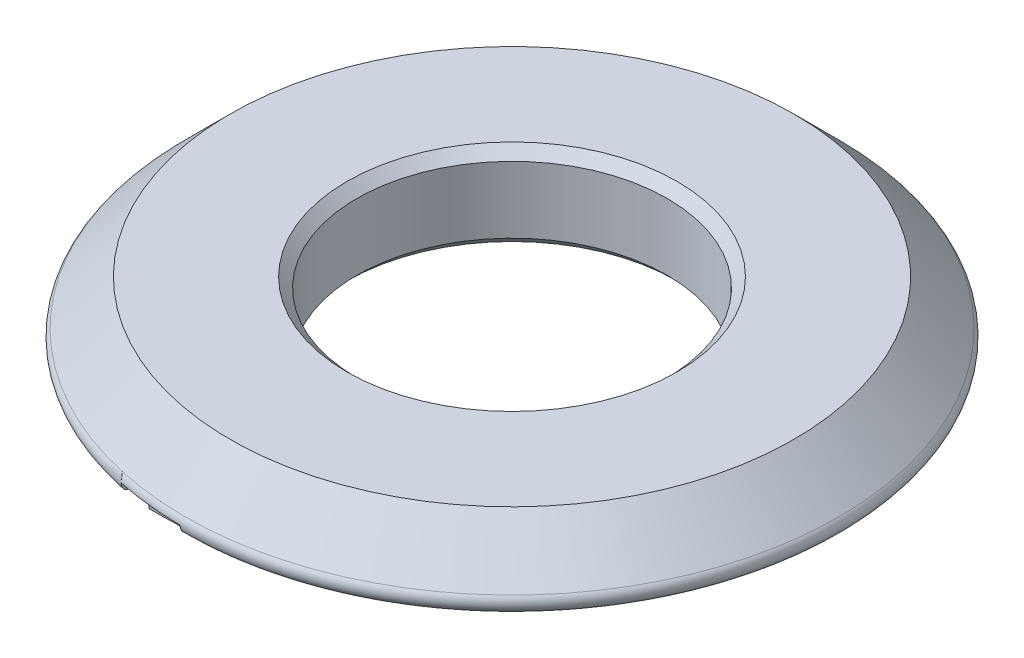
from build123d import *

# Parameters (mm, degrees)
CUT_EXTRUDE1_DEPTH = 0.254
FILLET1_R          = 0.254
CHAMFER1_SIZE      = 0.254


with BuildPart() as part:
    # Sketch1 → Revolve1 (revolve)
    with BuildSketch(Plane(origin=(0, 0, 0), x_dir=(0, 0, -1), z_dir=(1, 0, 0))):
        Polygon((4, 1.5875), (7.2644, 1.5875), (8.8519, 0), (5.001617421, 0), (4.635, -0.635), (4, -0.635), align=None)
    revolve(axis=Axis((0, 0, 0), (0, 1, 0)))

    # Sketch2 → Cut-Extrude1 (cut)
    with BuildSketch(Plane.XZ):
        with BuildLine():
            add(Edge.make_bspline(
                [(-0.381744141, 8.255992421), (-0.394148352, 8.256178311), (-0.423187535, 8.256613494), (-0.473293055, 8.259130399), (-0.53654551, 8.262859643), (-0.613190554, 8.268138747), (-0.703230056, 8.274867629), (-0.806419208, 8.283046817), (-0.922749653, 8.292772007), (-1.004591888, 8.299872891), (-1.04775, 8.303617421)],
                knots=[0, 0, 0, 0, 0.445813027, 1.043681475, 1.802721911, 2.723031118, 3.80466259, 5.047648995, 6.443127856, 8, 8, 8, 8], degree=3))
            add(Edge.make_bspline(
                [(-1.04775, 8.303617421), (-1.051396425, 8.263199144), (-1.058996997, 8.178951697), (-1.067294907, 8.0476609), (-1.076124262, 7.906819915), (-1.08128668, 7.756435685), (-1.087173295, 7.596473325), (-1.089413647, 7.427021867), (-1.092090416, 7.247938075), (-1.092293844, 7.125396111), (-1.092398438, 7.062390858)],
                knots=[0, 0, 0, 0, 0.783875404, 1.633901941, 2.541011057, 3.50963479, 4.54033398, 5.632943764, 6.782972208, 8, 8, 8, 8], degree=3))
            Line((-1.092398438, 7.062390858), (-1.095375, 5.922367421))
            add(Edge.make_bspline(
                [(-1.095375, 5.922367421), (-0.981029397, 5.924722631), (-0.750122342, 5.929478691), (-0.519166273, 5.92969808), (-0.402580078, 5.929808827)],
                knots=[0, 0, 0, 0, 0.990403717, 2, 2, 2, 2], degree=3))
            add(Edge.make_bspline(
                [(-0.402580078, 5.929808827), (-0.3778846, 5.928842867), (-0.330203814, 5.92697784), (-0.262128287, 5.907417169), (-0.200566431, 5.87590303), (-0.147812513, 5.83146931), (-0.102652506, 5.780410203), (-0.071321194, 5.721641824), (-0.05030196, 5.658376671), (-0.048531793, 5.613971834), (-0.047625, 5.591224843)],
                knots=[0, 0, 0, 0, 1.082052957, 2.089173409, 3.083186474, 4.097294582, 5.101700896, 6.05723862, 7.004793642, 8, 8, 8, 8], degree=3))
            add(Edge.make_bspline(
                [(-0.047625, 5.591224843), (-0.048980318, 5.56877771), (-0.051634529, 5.52481796), (-0.070761826, 5.460971112), (-0.104332019, 5.403341806), (-0.149259439, 5.352142048), (-0.202934175, 5.308714823), (-0.265507728, 5.277978369), (-0.334446566, 5.258502273), (-0.382848663, 5.256598426), (-0.407789063, 5.255617421)],
                knots=[0, 0, 0, 0, 0.981990313, 1.923098611, 2.885936941, 3.87867145, 4.890923925, 5.886267153, 6.910845923, 8, 8, 8, 8], degree=3))
            add(Edge.make_bspline(
                [(-0.407789063, 5.255617421), (-0.435075084, 5.255724172), (-0.495604144, 5.25596098), (-0.595555923, 5.25374919), (-0.71364547, 5.253022179), (-0.843843505, 5.249251009), (-0.973838881, 5.247854244), (-1.091643262, 5.244867505), (-1.191370785, 5.244610591), (-1.25189295, 5.243990653), (-1.279177734, 5.243711171)],
                knots=[0, 0, 0, 0, 0.75140939, 1.666864596, 2.753078635, 4.003449207, 5.253689156, 6.333180816, 7.248559561, 8, 8, 8, 8], degree=3))
            add(Edge.make_bspline(
                [(-1.279177734, 5.243711171), (-1.294308085, 5.243478352), (-1.326310082, 5.242985919), (-1.377212084, 5.241877836), (-1.433465174, 5.237510899), (-1.495281051, 5.233481824), (-1.562194982, 5.22704651), (-1.634489572, 5.220947909), (-1.712004706, 5.211319428), (-1.793150096, 5.202213493), (-1.874420126, 5.192227801), (-1.952134695, 5.184482209), (-2.024261581, 5.17673355), (-2.090990985, 5.170750566), (-2.152511234, 5.16616027), (-2.208850861, 5.163488199), (-2.259683405, 5.160823032), (-2.291702033, 5.160513652), (-2.306835938, 5.160367421)],
                knots=[0, 0, 0, 0, 0.704160305, 1.489359833, 2.368452763, 3.328943639, 4.371824874, 5.496213545, 6.704552097, 8.005941836, 9.295867175, 10.514415829, 11.63992951, 12.67131452, 13.631805396, 14.510216124, 15.295839695, 16, 16, 16, 16], degree=3))
            add(Edge.make_bspline(
                [(-2.306835938, 5.160367421), (-2.33177637, 5.161617404), (-2.380225763, 5.164045627), (-2.449733294, 5.184122637), (-2.512388393, 5.217220169), (-2.566682896, 5.263020484), (-2.611030114, 5.317651964), (-2.643968124, 5.378872086), (-2.662994501, 5.445999061), (-2.665646186, 5.492384587), (-2.667, 5.51606664)],
                knots=[0, 0, 0, 0, 1.059674382, 2.058528156, 3.049994519, 4.054020422, 5.059487538, 6.027361096, 6.992872509, 8, 8, 8, 8], degree=3))
            add(Edge.make_bspline(
                [(-2.667, 5.51606664), (-2.665789543, 5.540036481), (-2.663411508, 5.587127067), (-2.642285047, 5.654424662), (-2.608937628, 5.716528076), (-2.561793608, 5.770657886), (-2.505673524, 5.817157432), (-2.440697844, 5.851306013), (-2.368240151, 5.870984033), (-2.317869993, 5.87346559), (-2.291953125, 5.874742421)],
                knots=[0, 0, 0, 0, 0.992985397, 1.95079569, 2.900097383, 3.900955296, 4.911042762, 5.910628263, 6.924959263, 8, 8, 8, 8], degree=3))
            add(Edge.make_bspline(
                [(-2.291953125, 5.874742421), (-2.258962891, 5.874742421), (-2.188269531, 5.874742421), (-2.074912109, 5.874742421), (-1.947167969, 5.874742421), (-1.857126953, 5.874742421), (-1.80975, 5.874742421)],
                knots=[0, 0, 0, 0, 0.820987654, 1.759259259, 2.820987654, 4, 4, 4, 4], degree=3))
            add(Edge.make_bspline(
                [(-1.80975, 5.874742421), (-1.810314901, 5.902770845), (-1.811554597, 5.964280229), (-1.811957596, 6.06524314), (-1.812801985, 6.183312077), (-1.813515552, 6.318746201), (-1.814214147, 6.471543065), (-1.815188454, 6.641454292), (-1.81489278, 6.82873084), (-1.814936255, 6.959203406), (-1.814958984, 7.027416249)],
                knots=[0, 0, 0, 0, 0.5836817, 1.280910478, 2.102084751, 3.042040837, 4.100779199, 5.283464622, 6.57975812, 8, 8, 8, 8], degree=3))
            add(Edge.make_bspline(
                [(-1.814958984, 7.027416249), (-1.814549673, 7.14177609), (-1.813740638, 7.367816819), (-1.802414374, 7.702714662), (-1.78694107, 8.029772757), (-1.770336995, 8.244863482), (-1.762125, 8.351242421)],
                knots=[0, 0, 0, 0, 1.03546784, 2.04667918, 3.033932318, 4, 4, 4, 4], degree=3))
            Line((-1.762125, 8.351242421), (-2.310556641, 8.351242421))
            add(Edge.make_bspline(
                [(-2.310556641, 8.351242421), (-2.33497789, 8.352344963), (-2.382230296, 8.354478261), (-2.450166042, 8.372260987), (-2.512122392, 8.401335491), (-2.565925151, 8.442476915), (-2.611306924, 8.491324177), (-2.643648785, 8.547853993), (-2.663206972, 8.610438813), (-2.665708632, 8.653963991), (-2.667, 8.676431874)],
                knots=[0, 0, 0, 0, 1.087496504, 2.104184986, 3.108465136, 4.119361848, 5.105884215, 6.062056377, 6.999625195, 8, 8, 8, 8], degree=3))
            add(Edge.make_bspline(
                [(-2.667, 8.676431874), (-2.665999382, 8.698905878), (-2.664049403, 8.742702626), (-2.644699778, 8.804598468), (-2.613705998, 8.86050837), (-2.583956988, 8.890380697), (-2.568773437, 8.905627187)],
                knots=[0, 0, 0, 0, 1.046658878, 2.039701267, 2.999486214, 4, 4, 4, 4], degree=3))
            add(Edge.make_bspline(
                [(-2.568773437, 8.905627187), (-2.553047661, 8.918362833), (-2.521854552, 8.943624821), (-2.467557716, 8.971467515), (-2.408113906, 8.990269153), (-2.366246653, 8.995806522), (-2.344787109, 8.998644765)],
                knots=[0, 0, 0, 0, 0.982335062, 1.948525965, 2.948493336, 4, 4, 4, 4], degree=3))
            add(Edge.make_bspline(
                [(-2.344787109, 8.998644765), (-2.325198031, 9.000233954), (-2.282581407, 9.003691282), (-2.213327545, 9.006974031), (-2.134220512, 9.010875993), (-2.045168334, 9.013998193), (-1.946174439, 9.014987861), (-1.837036218, 9.016515816), (-1.717978169, 9.018410773), (-1.635373872, 9.018135451), (-1.592460938, 9.017992421)],
                knots=[0, 0, 0, 0, 0.626560248, 1.363100493, 2.210219051, 3.151846138, 4.203777764, 5.366415193, 6.631852641, 8, 8, 8, 8], degree=3))
            add(Edge.make_bspline(
                [(-1.592460938, 9.017992421), (-1.550785454, 9.017686936), (-1.464683946, 9.017055805), (-1.331211509, 9.012291279), (-1.189062553, 9.004830226), (-1.037989472, 8.994315294), (-0.87823196, 8.980914814), (-0.709808533, 8.964406537), (-0.532926839, 8.945161576), (-0.412236736, 8.930330286), (-0.350490234, 8.922742421)],
                knots=[0, 0, 0, 0, 0.802496017, 1.65795601, 2.571502426, 3.543419532, 4.573943291, 5.658517533, 6.802069544, 8, 8, 8, 8], degree=3))
            add(Edge.make_bspline(
                [(-0.350490234, 8.922742421), (-0.326726562, 8.918837897), (-0.281230469, 8.911362598), (-0.218984697, 8.887841165), (-0.165728483, 8.857356478), (-0.121746848, 8.818368621), (-0.087764553, 8.770520952), (-0.064054993, 8.714394571), (-0.049636516, 8.65061215), (-0.048317493, 8.605572201), (-0.047625, 8.581926015)],
                knots=[0, 0, 0, 0, 1.135697252, 2.174318321, 3.125291449, 4.021894543, 4.929465666, 5.87456831, 6.884138316, 8, 8, 8, 8], degree=3))
            add(Edge.make_bspline(
                [(-0.047625, 8.581926015), (-0.049015042, 8.556950808), (-0.051712941, 8.50847703), (-0.073827254, 8.439948819), (-0.11114633, 8.379381304), (-0.146431705, 8.348442235), (-0.164455078, 8.332638905)],
                knots=[0, 0, 0, 0, 1.048646388, 2.035292539, 2.99644947, 4, 4, 4, 4], degree=3))
            add(Edge.make_bspline(
                [(-0.164455078, 8.332638905), (-0.180712193, 8.320869047), (-0.212472715, 8.297875002), (-0.266274204, 8.273847636), (-0.322802537, 8.258156221), (-0.362043894, 8.256715635), (-0.381744141, 8.255992421)],
                knots=[0, 0, 0, 0, 1.02328265, 1.999124094, 2.995504957, 4, 4, 4, 4], degree=3))
        make_face()
        with BuildLine():
            add(Edge.make_bspline(
                [(2.307580078, 5.065117421), (2.282446415, 5.065800129), (2.234706059, 5.067096905), (2.167282725, 5.081507056), (2.10818073, 5.104805835), (2.058595499, 5.139450045), (2.017524266, 5.182557097), (1.985639293, 5.23556243), (1.963400135, 5.298104904), (1.956324282, 5.3435038), (1.952625, 5.367238515)],
                knots=[0, 0, 0, 0, 1.156667734, 2.197042673, 3.160862773, 4.064641839, 4.962254169, 5.885702344, 6.894637189, 8, 8, 8, 8], degree=3))
            add(Edge.make_bspline(
                [(1.952625, 5.367238515), (1.94740858, 5.453062283), (1.936945698, 5.625204097), (1.926572557, 5.797351341), (1.921371094, 5.883672108)],
                knots=[0, 0, 0, 0, 0.997128672, 2, 2, 2, 2], degree=3))
            add(Edge.make_bspline(
                [(1.921371094, 5.883672108), (1.916787796, 5.972453673), (1.907906461, 6.144491129), (1.905947851, 6.316745053), (1.905, 6.400105702)],
                knots=[0, 0, 0, 0, 1.032119017, 2, 2, 2, 2], degree=3))
            add(Edge.make_bspline(
                [(1.905, 6.400105702), (1.905, 6.412756093), (1.905, 6.442025624), (1.905, 6.491634999), (1.905, 6.552902577), (1.905, 6.621859608), (1.905, 6.691064687), (1.905, 6.752580312), (1.905, 6.802437733), (1.905, 6.831707265), (1.905, 6.844357655)],
                knots=[0, 0, 0, 0, 0.683417085, 1.581239531, 2.680067002, 3.993299832, 5.306532663, 6.418760469, 7.316582915, 8, 8, 8, 8], degree=3))
            add(Edge.make_bspline(
                [(1.905, 6.844357655), (1.905, 6.848326405), (1.905, 6.858496327), (1.905, 6.877099843), (1.905, 6.902400624), (1.905, 6.943080312), (1.905, 6.992689687), (1.905, 7.031633046), (1.905, 7.048996327)],
                knots=[0, 0, 0, 0, 0.349090909, 0.894545455, 1.636363636, 2.574545455, 4.472727273, 6, 6, 6, 6], degree=3))
            add(Edge.make_bspline(
                [(1.905, 7.048996327), (1.904774798, 7.065122815), (1.904350721, 7.095490492), (1.899735373, 7.137836135), (1.890031332, 7.17339465), (1.880295415, 7.203861861), (1.863784822, 7.226817574), (1.844920634, 7.244264092), (1.821551564, 7.254444888), (1.804881929, 7.25538603), (1.796355469, 7.255867421)],
                knots=[0, 0, 0, 0, 1.484135674, 2.794765622, 3.90181177, 4.876770419, 5.712506497, 6.472518646, 7.218698663, 8, 8, 8, 8], degree=3))
            add(Edge.make_bspline(
                [(1.796355469, 7.255867421), (1.776944235, 7.25494201), (1.737966967, 7.25308381), (1.679745491, 7.239877663), (1.622241063, 7.21775587), (1.564178664, 7.187875974), (1.507515785, 7.147891319), (1.450321686, 7.100598629), (1.393759019, 7.044604675), (1.33891865, 6.979992186), (1.284533796, 6.909785955), (1.23377474, 6.833821033), (1.184687525, 6.754116183), (1.14060885, 6.668808478), (1.098011467, 6.579638921), (1.05829517, 6.485700391), (1.023100031, 6.386747646), (1.001428788, 6.319054179), (0.990451172, 6.284763905)],
                knots=[0, 0, 0, 0, 0.698082469, 1.401731962, 2.135950516, 2.910233417, 3.744369755, 4.625260287, 5.578061921, 6.603051052, 7.672148989, 8.771033945, 9.888208258, 11.037771143, 12.223242519, 13.443011462, 14.704751846, 16, 16, 16, 16], degree=3))
            add(Edge.make_bspline(
                [(0.990451172, 6.284763905), (0.989201213, 6.26938615), (0.986519396, 6.236392807), (0.982435115, 6.183471155), (0.975299443, 6.123752292), (0.970124133, 6.081611136), (0.967382812, 6.059289296)],
                knots=[0, 0, 0, 0, 0.816748744, 1.752354084, 2.809439597, 4, 4, 4, 4], degree=3))
            add(Edge.make_bspline(
                [(0.967382812, 6.059289296), (0.963042088, 6.021627054), (0.954436094, 5.946957248), (0.953141581, 5.871805333), (0.9525, 5.834558827)],
                knots=[0, 0, 0, 0, 1.00876763, 2, 2, 2, 2], degree=3))
            add(Edge.make_bspline(
                [(0.9525, 5.834558827), (0.9525, 5.821164296), (0.9525, 5.791398671), (0.9525, 5.742037343), (0.9525, 5.68349828), (0.9525, 5.618758046), (0.9525, 5.554017812), (0.9525, 5.495478749), (0.9525, 5.445869374), (0.9525, 5.415855702), (0.9525, 5.402213124)],
                knots=[0, 0, 0, 0, 0.743545611, 1.65232358, 2.74010327, 3.993115318, 5.246127367, 6.333907057, 7.242685026, 8, 8, 8, 8], degree=3))
            add(Edge.make_bspline(
                [(0.9525, 5.402213124), (0.95150355, 5.379004514), (0.949561284, 5.333766633), (0.930028519, 5.269203887), (0.898970603, 5.210790974), (0.856643196, 5.159374158), (0.804320741, 5.118004191), (0.745362029, 5.086427585), (0.678962932, 5.068269133), (0.632629201, 5.06619058), (0.608707031, 5.065117421)],
                knots=[0, 0, 0, 0, 1.03281311, 2.013144059, 2.978372729, 3.968643917, 4.960520983, 5.935529962, 6.934111263, 8, 8, 8, 8], degree=3))
            add(Edge.make_bspline(
                [(0.608707031, 5.065117421), (0.585022544, 5.066187274), (0.538917237, 5.0682699), (0.473043975, 5.086643402), (0.413707927, 5.11689007), (0.362476012, 5.158699023), (0.320553201, 5.209593878), (0.28941148, 5.267593794), (0.271068195, 5.332415155), (0.26896915, 5.377539293), (0.267890625, 5.400724843)],
                knots=[0, 0, 0, 0, 1.060614024, 2.064639789, 3.039838215, 4.028460469, 5.008469718, 5.978961007, 6.961555787, 8, 8, 8, 8], degree=3))
            add(Edge.make_bspline(
                [(0.267890625, 5.400724843), (0.267770465, 5.414124299), (0.267503198, 5.443928105), (0.263909766, 5.493266606), (0.259846961, 5.551613888), (0.253007812, 5.615781483), (0.246168664, 5.679949079), (0.242105859, 5.73829636), (0.238512427, 5.787634862), (0.23824516, 5.817438668), (0.238125, 5.830838124)],
                knots=[0, 0, 0, 0, 0.745452016, 1.658075322, 2.751597369, 4, 5.248402631, 6.341924678, 7.254547984, 8, 8, 8, 8], degree=3))
            add(Edge.make_bspline(
                [(0.238125, 5.830838124), (0.23840713, 5.85216949), (0.23899763, 5.896816278), (0.239221037, 5.96678599), (0.242170307, 6.042661318), (0.243686975, 6.124556223), (0.248172071, 6.212319397), (0.251160714, 6.306134852), (0.25712384, 6.405791416), (0.261546634, 6.509527355), (0.26828997, 6.613381346), (0.271935541, 6.713407817), (0.277201185, 6.80736326), (0.279438547, 6.89521928), (0.283198278, 6.977285409), (0.283957738, 7.053466982), (0.286138137, 7.123648573), (0.285875478, 7.168305391), (0.28575, 7.189638905)],
                knots=[0, 0, 0, 0, 0.753058534, 1.576159957, 2.469648235, 3.433155657, 4.467279288, 5.571391323, 6.746282082, 7.991130045, 9.236439822, 10.419653559, 11.52414743, 12.557937394, 13.52172327, 14.423751246, 15.246992371, 16, 16, 16, 16], degree=3))
            add(Edge.make_bspline(
                [(0.28575, 7.189638905), (0.28575, 7.203777577), (0.28575, 7.23527953), (0.28575, 7.287369374), (0.28575, 7.348884999), (0.28575, 7.416601796), (0.28575, 7.484318593), (0.28575, 7.545586171), (0.28575, 7.597179921), (0.28575, 7.62818578), (0.28575, 7.642076405)],
                knots=[0, 0, 0, 0, 0.75, 1.671052632, 2.763157895, 4.013157895, 5.263157895, 6.355263158, 7.263157895, 8, 8, 8, 8], degree=3))
            add(Edge.make_bspline(
                [(0.28575, 7.642076405), (0.286870692, 7.664752832), (0.289063132, 7.709115318), (0.306904201, 7.772716097), (0.338908621, 7.829020813), (0.380268833, 7.878728177), (0.430690184, 7.919783896), (0.488262085, 7.949220788), (0.551373355, 7.966878103), (0.595199032, 7.969103217), (0.617636719, 7.970242421)],
                knots=[0, 0, 0, 0, 1.044016622, 2.042436971, 3.009288417, 4.00725079, 5.006782492, 5.983044561, 6.967367616, 8, 8, 8, 8], degree=3))
            add(Edge.make_bspline(
                [(0.617636719, 7.970242421), (0.642077457, 7.969271344), (0.689018788, 7.967406276), (0.754871326, 7.948468823), (0.811813761, 7.917356192), (0.859035604, 7.873532292), (0.897100819, 7.817694414), (0.923676964, 7.74912879), (0.943603171, 7.66939405), (0.94795549, 7.61170376), (0.950267578, 7.581056874)],
                knots=[0, 0, 0, 0, 1.013300018, 1.946162677, 2.81799956, 3.685929579, 4.597778473, 5.600595704, 6.725361425, 8, 8, 8, 8], degree=3))
            Line((0.950267578, 7.581056874), (0.9525, 7.553523671))
            add(Edge.make_bspline(
                [(0.9525, 7.553523671), (0.984335449, 7.582769685), (1.046395641, 7.639782018), (1.14415407, 7.71539809), (1.243614241, 7.778958816), (1.344218605, 7.831694527), (1.446649649, 7.871845232), (1.549949087, 7.90140623), (1.654863384, 7.918989957), (1.725350122, 7.921407278), (1.760636719, 7.922617421)],
                knots=[0, 0, 0, 0, 1.138458514, 2.21931705, 3.250692209, 4.244347634, 5.206568234, 6.143610746, 7.070666891, 8, 8, 8, 8], degree=3))
            add(Edge.make_bspline(
                [(1.760636719, 7.922617421), (1.800396983, 7.921595946), (1.877409973, 7.919617417), (1.988086384, 7.901001257), (2.08914615, 7.869475439), (2.180724191, 7.826464187), (2.262881742, 7.770420153), (2.334422506, 7.701114419), (2.397325819, 7.620065778), (2.42953047, 7.558794458), (2.445990234, 7.527478749)],
                knots=[0, 0, 0, 0, 1.135868455, 2.200101703, 3.195780642, 4.153577706, 5.081841206, 6.024613901, 6.990382182, 8, 8, 8, 8], degree=3))
            add(Edge.make_bspline(
                [(2.445990234, 7.527478749), (2.456345968, 7.504082698), (2.477789821, 7.455635966), (2.502610986, 7.376439909), (2.523984917, 7.289425649), (2.541895287, 7.194057216), (2.554813378, 7.090647167), (2.564471512, 6.979195726), (2.570399617, 6.859551866), (2.571290226, 6.77689577), (2.57175, 6.734224843)],
                knots=[0, 0, 0, 0, 0.758504084, 1.57065161, 2.457657005, 3.415967795, 4.447349612, 5.547941851, 6.734133371, 8, 8, 8, 8], degree=3))
            Line((2.57175, 6.734224843), (2.57175, 6.556375233))
            add(Edge.make_bspline(
                [(2.57175, 6.556375233), (2.571501899, 6.538515833), (2.571047038, 6.505772968), (2.570424062, 6.460874779), (2.569364002, 6.424418442), (2.569470895, 6.402834709), (2.569517578, 6.393408437)],
                knots=[0, 0, 0, 0, 1.315042326, 2.410957427, 3.306016816, 4, 4, 4, 4], degree=3))
            add(Edge.make_bspline(
                [(2.569517578, 6.393408437), (2.570190401, 6.358668662), (2.571634009, 6.284131023), (2.580980034, 6.165427351), (2.597259149, 6.03254613), (2.61755251, 5.890533255), (2.639565492, 5.749018266), (2.655461533, 5.61679053), (2.664895697, 5.49884306), (2.666331259, 5.424799342), (2.667, 5.390306874)],
                knots=[0, 0, 0, 0, 0.826548602, 1.773442205, 2.831196354, 4.011321354, 5.186448247, 6.238341759, 7.179350484, 8, 8, 8, 8], degree=3))
            add(Edge.make_bspline(
                [(2.667, 5.390306874), (2.665759868, 5.367821781), (2.663340282, 5.323951782), (2.642851942, 5.26132743), (2.610605411, 5.204252329), (2.564596048, 5.155493094), (2.509887002, 5.115752123), (2.448151911, 5.085583184), (2.379667871, 5.0685871), (2.331978606, 5.066291754), (2.307580078, 5.065117421)],
                knots=[0, 0, 0, 0, 0.996006959, 1.943279693, 2.895277007, 3.884932907, 4.893702341, 5.883664512, 6.917251732, 8, 8, 8, 8], degree=3))
        make_face()
    extrude(amount=-CUT_EXTRUDE1_DEPTH, mode=Mode.SUBTRACT)

    # Fillet1
    # the kernel refuses this fillet: 0.254 mm, written as the material it takes off along each edge
    with BuildSketch(Plane(origin=(0, 0, 0), x_dir=(-0.19035255072542256, 0, 0.9817157971797772), z_dir=(-0.9817157971797772, 0, -0.19035255072542256))) as fillet1_piece_1:
        with BuildLine():
            CenterArc((8.8519 - FILLET1_R * 2.41421356237, FILLET1_R), FILLET1_R, 270, 135)
            Line((8.8519 - FILLET1_R * 2.41421356237, 0), (8.8519, 0))
            Line((8.8519, 0), (8.8519 - FILLET1_R * 1.70710678119, FILLET1_R * 1.70710678119))
        make_face()
    revolve(axis=Axis((0, 0, 0), (0, 1, 0)), revolution_arc=190.973359365, mode=Mode.SUBTRACT)
    with BuildSketch(Plane(origin=(0, 0, 0), x_dir=(0, 0, -1), z_dir=(1, 0, 0))) as fillet1_piece_2:
        with BuildLine():
            CenterArc((8.8519 - FILLET1_R * 2.41421356237, FILLET1_R), FILLET1_R, 270, 135)
            Line((8.8519 - FILLET1_R * 2.41421356237, 0), (8.8519, 0))
            Line((8.8519, 0), (8.8519 - FILLET1_R * 1.70710678119, FILLET1_R * 1.70710678119))
        make_face()
    revolve(axis=Axis((0, 0, 0), (0, 1, 0)), revolution_arc=172.945554592, mode=Mode.SUBTRACT)

    # Chamfer1
    chamfer1_edges = [part.edges().sort_by_distance(p)[0] for p in [
        (0, -0.635, 4),
        (0, 1.5875, 4),
    ]]
    chamfer(chamfer1_edges, length=CHAMFER1_SIZE)


solid = part.part
